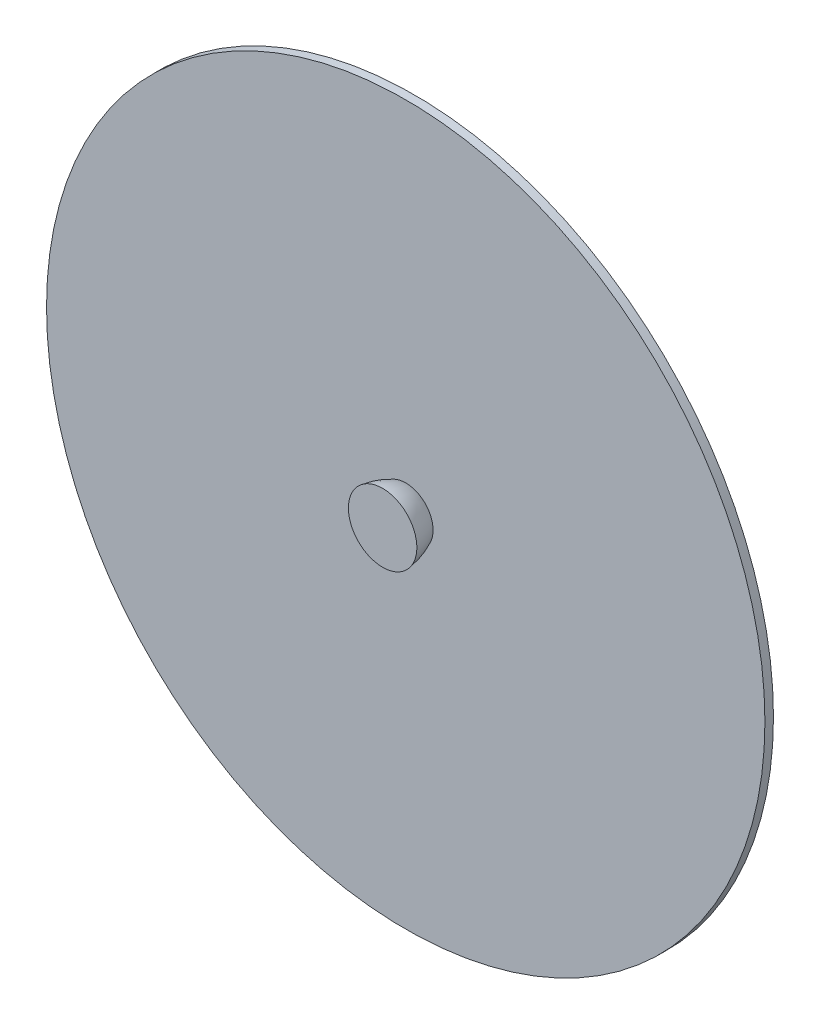
from build123d import *


with BuildPart() as part:
    # Esboço1 → Revolução1 (revolve)
    with BuildSketch(Plane(origin=(0, 0, 0), x_dir=(1, 0, 0), z_dir=(0, 1, 0))):
        with BuildLine():
            Line((-200, 700), (0, 700))
            Line((0, 700), (0, 1000))
            add(Edge.make_bspline(
                [(0, 1000), (-81.025327418, 953.561138232), (-130, 885)],
                knots=[0, 0, 0, 0.467370656, 0.467370656, 0.467370656], degree=2))
            Line((-130, 885), (-2100, 885))
            Line((-2100, 885), (-2100, 835))
            Line((-2100, 835), (-160.007402969, 835))
            add(Edge.make_bspline(
                [(-160.007402969, 835), (-190.112692032, 774.477513715), (-200, 700)],
                knots=[0.628796655, 0.628796655, 0.628796655, 1, 1, 1], degree=2))
        make_face()
    revolve(axis=Axis((0, 0, -1000), (0, 0, 1)))


solid = part.part
